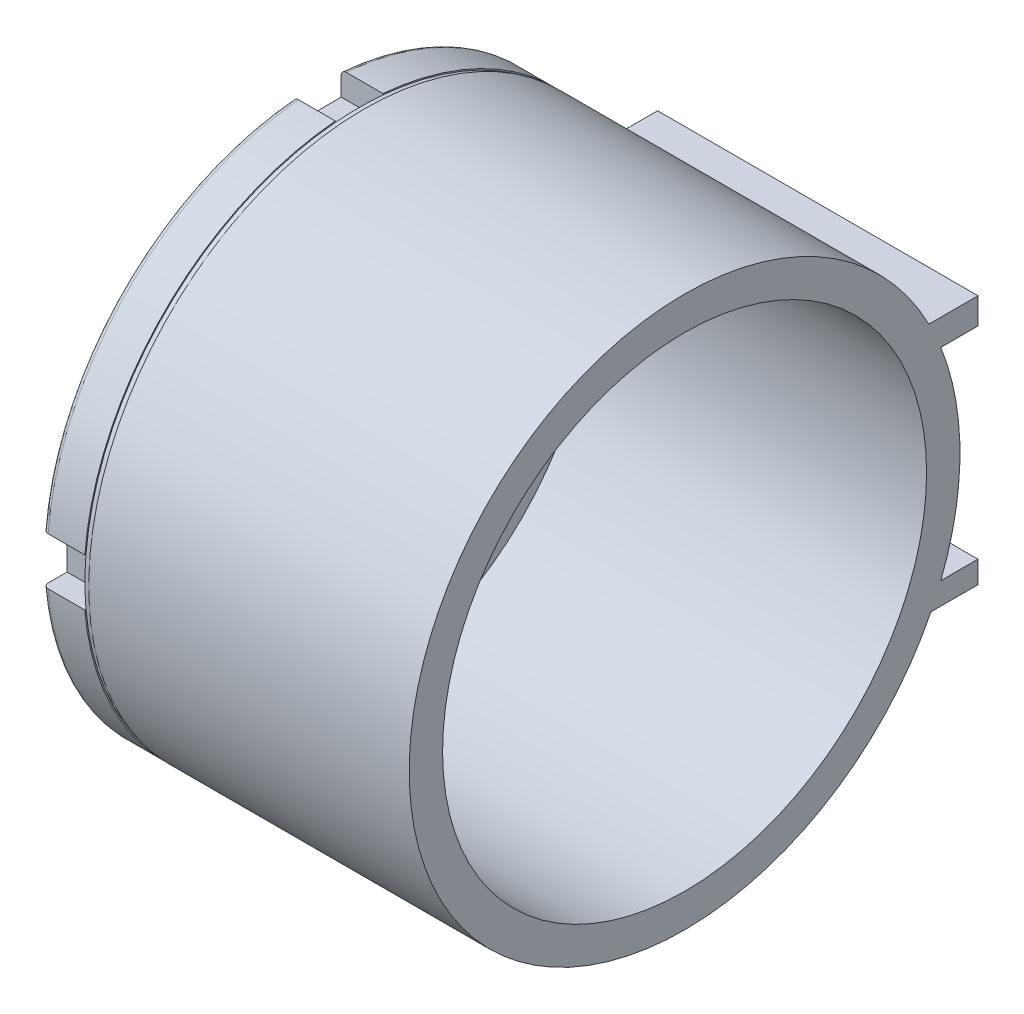
from build123d import *

# Parameters (mm, degrees)
SKETCH1_R           = 16.5
BOSS_EXTRUDE1_DEPTH = 22
SKETCH2_W           = 2.99551857
SKETCH2_H           = 2.853303302
SKETCH2_W_2         = 2.853303302
SKETCH2_H_2         = 2.99551857
CUT_EXTRUDE1_DEPTH  = 2.5
SKETCH3_R           = 4
BOSS_EXTRUDE2_DEPTH = 2.2
CUT_EXTRUDE2_DEPTH  = 12.2
SKETCH5_W           = 3.219111416
SKETCH5_H           = 1.024262723
BOSS_EXTRUDE3_DEPTH = 3
CUT_EXTRUDE3_DEPTH  = 3
CIRPATTERN2_COUNT   = 2
SHELL1_START        = 2
SHELL1_DEPTH        = 20
SHELL1_START_2      = 14.2
SHELL1_2_DEPTH      = 7.8
SHELL1_START_3      = 4.5
SHELL1_3_DEPTH      = 9.7
SHELL1_START_4      = -0.2
SHELL1_4_OUTLINE_R  = 2
SHELL1_4_DEPTH      = 2.2
SKETCH7_R           = 9.780494134
CUT_EXTRUDE4_DEPTH  = 28
SKETCH8_R           = 16.5
SKETCH8_R_2         = 16.427034369
CUT_EXTRUDE5_DEPTH  = 0.3
FILLET1_R           = 0.3
FILLET2_R           = 0.8
SKETCH9_W           = 19.2
SKETCH9_H           = 1.567367832
SKETCH9_H_2         = 1.325546631
BOSS_EXTRUDE4_DEPTH = 3


# Read off the part's stored shape, not the designer's step: Shell1
with BuildPart() as part:
    # Sketch1 → Boss-Extrude1 (new body)
    with BuildSketch(Plane(origin=(0, 0, 0), x_dir=(0, 0, -1), z_dir=(1, 0, 0))):
        Circle(SKETCH1_R)
    extrude(amount=BOSS_EXTRUDE1_DEPTH)

    # Sketch2 → Cut-Extrude1 (cut)
    with BuildSketch(Plane.ZY):
        with Locations((-16.5, 0)):
            Rectangle(SKETCH2_W, SKETCH2_H)
        with Locations((0, 16.5)):
            Rectangle(SKETCH2_W_2, SKETCH2_H_2)
        with Locations((16.5, 0)):
            Rectangle(SKETCH2_W, SKETCH2_H)
        with Locations((0, -16.5)):
            Rectangle(SKETCH2_W_2, SKETCH2_H_2)
    extrude(amount=-CUT_EXTRUDE1_DEPTH, mode=Mode.SUBTRACT)

    # Sketch3 → Boss-Extrude2 (add)
    with BuildSketch(Plane.ZY):
        Circle(SKETCH3_R)
    extrude(amount=BOSS_EXTRUDE2_DEPTH)

    # Sketch4 → Cut-Extrude2 (cut)
    with BuildSketch(Plane.ZY):
        with BuildLine():
            ThreePointArc((2.706980055, 5.596864168), (0.036580812, 6.702979752), (-2.633818432, 5.596864168))
            ThreePointArc((-2.633818432, 5.596864168), (-2.633818432, 4.865247937), (-1.902202201, 4.865247937))
            ThreePointArc((-1.902202201, 4.865247937), (0.036580812, 5.668318155), (1.975363824, 4.865247937))
            ThreePointArc((1.975363824, 4.865247937), (2.706980055, 4.865247937), (2.706980055, 5.596864168))
        make_face()
        with BuildLine():
            ThreePointArc((-2.706980055, -5.596864168), (-0.036580812, -6.702979752), (2.633818432, -5.596864168))
            ThreePointArc((2.633818432, -5.596864168), (2.633818432, -4.865247937), (1.902202201, -4.865247937))
            ThreePointArc((1.902202201, -4.865247937), (-0.036580812, -5.668318155), (-1.975363824, -4.865247937))
            ThreePointArc((-1.975363824, -4.865247937), (-2.706980055, -4.865247937), (-2.706980055, -5.596864168))
        make_face()
    extrude(amount=-CUT_EXTRUDE2_DEPTH, mode=Mode.SUBTRACT)

    # Sketch5 → Boss-Extrude3 (add)
    with BuildSketch(Plane.ZY):
        with Locations((0, 11.230309148)):
            Rectangle(SKETCH5_W, SKETCH5_H)
    boss_extrude3 = extrude(amount=BOSS_EXTRUDE3_DEPTH)

    # Sketch6 → Cut-Extrude3 (cut)
    with BuildSketch(Plane(origin=(0, 11.742440509, 0), x_dir=(1, 0, 0), z_dir=(0, 1, 0))):
        with BuildLine():
            Line((-1.239883538, -0.443858464), (-2.275602474, -0.443858464))
            ThreePointArc((-2.275602474, -0.443858464), (-2.719460937, 0), (-2.275602474, 0.443858464))
            Line((-2.275602474, 0.443858464), (-1.239883538, 0.443858464))
            ThreePointArc((-1.239883538, 0.443858464), (-0.796025074, 0), (-1.239883538, -0.443858464))
        make_face()
    cut_extrude3 = extrude(amount=-CUT_EXTRUDE3_DEPTH, mode=Mode.SUBTRACT)

    # CirPattern2: Boss-Extrude3, Cut-Extrude3 ×2 about axis
    cirpattern2_axis = Axis((0, 0, 0), (1, 0, 0))
    add([boss_extrude3.rotate(cirpattern2_axis, i * 360 / CIRPATTERN2_COUNT) for i in range(1, CIRPATTERN2_COUNT)])
    add([cut_extrude3.rotate(cirpattern2_axis, i * 360 / CIRPATTERN2_COUNT) for i in range(1, CIRPATTERN2_COUNT)], mode=Mode.SUBTRACT)

    # Shell1 outline → Shell1 (cut)
    with BuildSketch(Plane.YZ.offset(SHELL1_START)):
        with BuildLine():
            Line((13.002240715, 3.426651651), (14.089288785, 3.426651651))
            ThreePointArc((14.089288785, 3.426651651), (10.253048327, 10.253048327), (3.426651651, 14.089288785))
            Line((3.426651651, 14.089288785), (3.426651651, 13.002240715))
            Line((3.426651651, 13.002240715), (-3.426651651, 13.002240715))
            Line((-3.426651651, 13.002240715), (-3.426651651, 14.089288785))
            ThreePointArc((-3.426651651, 14.089288785), (-10.253048327, 10.253048327), (-14.089288785, 3.426651651))
            Line((-14.089288785, 3.426651651), (-13.002240715, 3.426651651))
            Line((-13.002240715, 3.426651651), (-13.002240715, -3.426651651))
            Line((-13.002240715, -3.426651651), (-14.089288785, -3.426651651))
            ThreePointArc((-14.089288785, -3.426651651), (-10.253048327, -10.253048327), (-3.426651651, -14.089288785))
            Line((-3.426651651, -14.089288785), (-3.426651651, -13.002240715))
            Line((-3.426651651, -13.002240715), (3.426651651, -13.002240715))
            Line((3.426651651, -13.002240715), (3.426651651, -14.089288785))
            ThreePointArc((3.426651651, -14.089288785), (10.253048327, -10.253048327), (14.089288785, -3.426651651))
            Line((14.089288785, -3.426651651), (13.002240715, -3.426651651))
            Line((13.002240715, -3.426651651), (13.002240715, 3.426651651))
        make_face()
        with BuildLine():
            ThreePointArc((-3.451034375, 0.487988639), (-3.668318155, -0.036580811), (-3.451034375, -0.561150262))
            ThreePointArc((-3.451034375, -0.561150262), (-3.451034375, -4.121193617), (-7.01107773, -4.121193617))
            ThreePointArc((-7.01107773, -4.121193617), (-8.702979752, -0.036580811), (-7.01107773, 4.048031994))
            ThreePointArc((-7.01107773, 4.048031994), (-3.451034375, 4.048031994), (-3.451034375, 0.487988639))
        make_face(mode=Mode.SUBTRACT)
        with BuildLine():
            ThreePointArc((3.451034375, -0.487988639), (3.668318155, 0.036580811), (3.451034375, 0.561150262))
            ThreePointArc((3.451034375, 0.561150262), (3.451034375, 4.121193617), (7.01107773, 4.121193617))
            ThreePointArc((7.01107773, 4.121193617), (8.702979752, 0.036580811), (7.01107773, -4.048031994))
            ThreePointArc((7.01107773, -4.048031994), (3.451034375, -4.048031994), (3.451034375, -0.487988639))
        make_face(mode=Mode.SUBTRACT)
    extrude(amount=SHELL1_DEPTH, mode=Mode.SUBTRACT)

    # Shell1 2 outline → Shell1 2 (cut)
    with BuildSketch(Plane.YZ.offset(SHELL1_START_2)):
        with BuildLine():
            ThreePointArc((14.089288785, -3.426651651), (14.5, 0), (14.089288785, 3.426651651))
            Line((14.089288785, 3.426651651), (13.002240715, 3.426651651))
            Line((13.002240715, 3.426651651), (13.002240715, -3.426651651))
            Line((13.002240715, -3.426651651), (14.089288785, -3.426651651))
        make_face()
        with BuildLine():
            Line((3.426651651, 13.002240715), (3.426651651, 14.089288785))
            ThreePointArc((3.426651651, 14.089288785), (0, 14.5), (-3.426651651, 14.089288785))
            Line((-3.426651651, 14.089288785), (-3.426651651, 13.002240715))
            Line((-3.426651651, 13.002240715), (3.426651651, 13.002240715))
        make_face()
        with BuildLine():
            ThreePointArc((-3.426651651, -14.089288785), (0, -14.5), (3.426651651, -14.089288785))
            Line((3.426651651, -14.089288785), (3.426651651, -13.002240715))
            Line((3.426651651, -13.002240715), (-3.426651651, -13.002240715))
            Line((-3.426651651, -13.002240715), (-3.426651651, -14.089288785))
        make_face()
        with BuildLine():
            Line((-13.002240715, 3.426651651), (-14.089288785, 3.426651651))
            ThreePointArc((-14.089288785, 3.426651651), (-14.5, 0), (-14.089288785, -3.426651651))
            Line((-14.089288785, -3.426651651), (-13.002240715, -3.426651651))
            Line((-13.002240715, -3.426651651), (-13.002240715, 3.426651651))
        make_face()
        with BuildLine():
            ThreePointArc((-7.01107773, -4.121193617), (-3.451034375, -4.121193617), (-3.451034375, -0.561150262))
            ThreePointArc((-3.451034375, -0.561150262), (-3.668318155, -0.036580811), (-3.451034375, 0.487988639))
            ThreePointArc((-3.451034375, 0.487988639), (-3.451034375, 4.048031994), (-7.01107773, 4.048031994))
            ThreePointArc((-7.01107773, 4.048031994), (-8.702979752, -0.036580811), (-7.01107773, -4.121193617))
        make_face()
        with BuildLine():
            ThreePointArc((7.01107773, 4.121193617), (3.451034375, 4.121193617), (3.451034375, 0.561150262))
            ThreePointArc((3.451034375, 0.561150262), (3.668318155, 0.036580811), (3.451034375, -0.487988639))
            ThreePointArc((3.451034375, -0.487988639), (3.451034375, -4.048031994), (7.01107773, -4.048031994))
            ThreePointArc((7.01107773, -4.048031994), (8.702979752, 0.036580811), (7.01107773, 4.121193617))
        make_face()
    extrude(amount=SHELL1_2_DEPTH, mode=Mode.SUBTRACT)

    # Shell1 3 outline → Shell1 3 (cut)
    with BuildSketch(Plane.YZ.offset(SHELL1_START_3)):
        with BuildLine():
            ThreePointArc((14.089288785, -3.426651651), (14.5, 0), (14.089288785, 3.426651651))
            Line((14.089288785, 3.426651651), (13.002240715, 3.426651651))
            Line((13.002240715, 3.426651651), (13.002240715, -3.426651651))
            Line((13.002240715, -3.426651651), (14.089288785, -3.426651651))
        make_face()
        with BuildLine():
            Line((3.426651651, 13.002240715), (3.426651651, 14.089288785))
            ThreePointArc((3.426651651, 14.089288785), (0, 14.5), (-3.426651651, 14.089288785))
            Line((-3.426651651, 14.089288785), (-3.426651651, 13.002240715))
            Line((-3.426651651, 13.002240715), (3.426651651, 13.002240715))
        make_face()
        with BuildLine():
            ThreePointArc((-3.426651651, -14.089288785), (0, -14.5), (3.426651651, -14.089288785))
            Line((3.426651651, -14.089288785), (3.426651651, -13.002240715))
            Line((3.426651651, -13.002240715), (-3.426651651, -13.002240715))
            Line((-3.426651651, -13.002240715), (-3.426651651, -14.089288785))
        make_face()
        with BuildLine():
            Line((-13.002240715, 3.426651651), (-14.089288785, 3.426651651))
            ThreePointArc((-14.089288785, 3.426651651), (-14.5, 0), (-14.089288785, -3.426651651))
            Line((-14.089288785, -3.426651651), (-13.002240715, -3.426651651))
            Line((-13.002240715, -3.426651651), (-13.002240715, 3.426651651))
        make_face()
    extrude(amount=SHELL1_3_DEPTH, mode=Mode.SUBTRACT)

    # Shell1 4 outline → Shell1 4 (cut)
    with BuildSketch(Plane.YZ.offset(SHELL1_START_4)):
        Circle(SHELL1_4_OUTLINE_R)
    extrude(amount=SHELL1_4_DEPTH, mode=Mode.SUBTRACT)

    # Sketch7 → Cut-Extrude4 (cut)
    with BuildSketch(Plane(origin=(2, 0, 0), x_dir=(0, 0, -1), z_dir=(1, 0, 0))):
        Circle(SKETCH7_R)
    extrude(amount=CUT_EXTRUDE4_DEPTH, mode=Mode.SUBTRACT)

    # Sketch8 → Cut-Extrude5 (cut)
    with BuildSketch(Plane.ZY.offset(-2.5)):
        Circle(SKETCH8_R)
        Circle(SKETCH8_R_2, mode=Mode.SUBTRACT)
    extrude(amount=-CUT_EXTRUDE5_DEPTH, mode=Mode.SUBTRACT)

    # Fillet1
    fillet1_edges = [part.edges().sort_by_distance(p)[0] for p in [
        (0, 11.66726189, -11.66726189),
        (0, 11.66726189, 11.66726189),
        (0, -11.66726189, 11.66726189),
        (0, -11.66726189, -11.66726189),
    ]]
    fillet(fillet1_edges, radius=FILLET1_R)

    # Fillet2
    fillet2_edges = [part.edges().sort_by_distance(p)[0] for p in [
        (-3, 11.230309148, 1.609555708),
        (-3, 11.230309148, -1.609555708),
        (-3, -11.230309148, -1.609555708),
        (-3, -11.230309148, 1.609555708),
    ]]
    fillet(fillet2_edges, radius=FILLET2_R)

    # Sketch9 → Boss-Extrude4 (add)
    with BuildSketch(Plane.XY.offset(-14.58)):
        with Locations((12.4, 6.833683916)):
            Rectangle(SKETCH9_W, SKETCH9_H)
        with Locations((12.4, -6.712773316)):
            Rectangle(SKETCH9_W, SKETCH9_H_2)
    extrude(amount=-BOSS_EXTRUDE4_DEPTH)


solid = part.part
